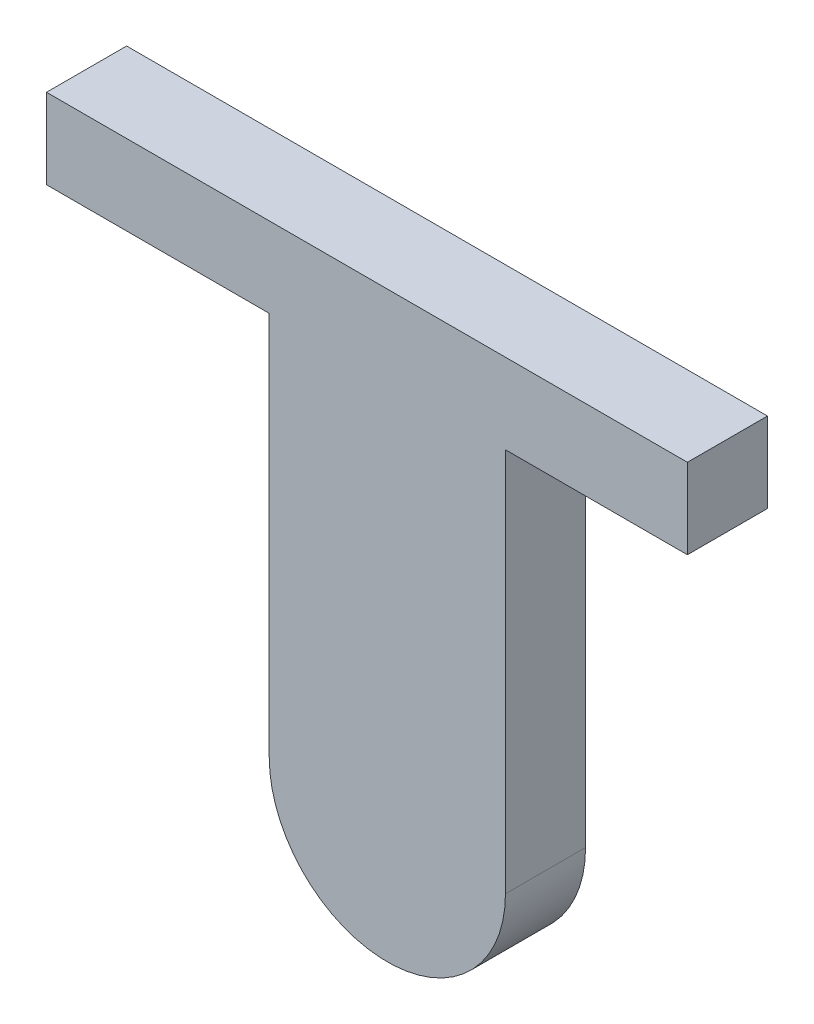
from build123d import *

# Parameters (mm, degrees)
BOSS_EXTRUDE1_DEPTH = 10


with BuildPart() as part:
    # Sketch1 → Boss-Extrude1 (new body)
    with BuildSketch(Plane.XY):
        with BuildLine():
            Line((-28.196328747, 45.483252753), (51.803671253, 45.483252753))
            Line((51.803671253, 45.483252753), (51.803671253, 35.483252753))
            Line((51.803671253, 35.483252753), (29.094054806, 35.483252753))
            Line((29.094054806, 35.483252753), (29.094054806, -12.516747247))
            ThreePointArc((29.094054806, -12.516747247), (14.350502374, -27.26029968), (-0.393050059, -12.516747247))
            Line((-0.393050059, -12.516747247), (-0.393050059, 35.483252753))
            Line((-0.393050059, 35.483252753), (-28.196328747, 35.483252753))
            Line((-28.196328747, 35.483252753), (-28.196328747, 45.483252753))
        make_face()
    extrude(amount=BOSS_EXTRUDE1_DEPTH)


solid = part.part
